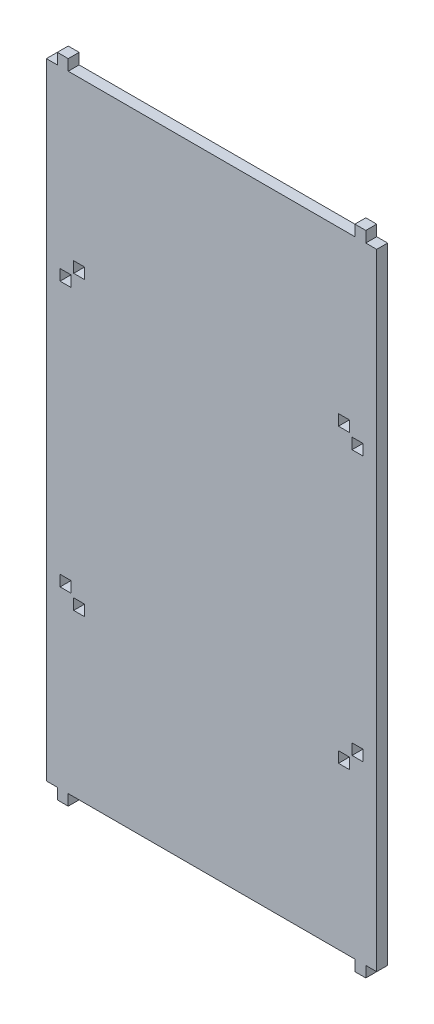
from build123d import *

# Parameters (mm, degrees)
SKETCH1_W           = 46.6
SKETCH1_H           = 97.8
BOSS_EXTRUDE1_DEPTH = 1.65
SKETCH3_W           = 1.65
SKETCH3_H           = 94.5
BOSS_EXTRUDE2_DEPTH = 1.65
SKETCH2_W           = 1.65
SKETCH2_H           = 1.65
CUT_EXTRUDE1_DEPTH  = 1.65
SKETCH4_W           = 43.3
SKETCH4_H           = 1.65
CUT_EXTRUDE2_DEPTH  = 1.65


with BuildPart() as part:
    # Sketch1 → Boss-Extrude1 (new body)
    with BuildSketch(Plane.XY):
        Rectangle(SKETCH1_W, SKETCH1_H)
    extrude(amount=BOSS_EXTRUDE1_DEPTH)

    # Sketch3 → Boss-Extrude2 (add)
    with BuildSketch(Plane.ZY.offset(23.3)):
        with Locations((0.825, 0)):
            Rectangle(SKETCH3_W, SKETCH3_H)
    boss_extrude2 = extrude(amount=BOSS_EXTRUDE2_DEPTH)

    # Mirror1: Boss-Extrude2 across plane
    add(boss_extrude2.mirror(Plane(origin=(0, 0, 0), x_dir=(0, 0, 1), z_dir=(1, 0, 0))))

    # Sketch2 → Cut-Extrude1 (cut)
    with BuildSketch(Plane.XY.offset(1.65)):
        with Locations((22.05, 20)):
            Rectangle(SKETCH2_W, SKETCH2_H)
        with Locations((22.05, -20)):
            Rectangle(SKETCH2_W, SKETCH2_H)
        with Locations((20, -22.05)):
            Rectangle(SKETCH2_W, SKETCH2_H)
        with Locations((-20, -22.05)):
            Rectangle(SKETCH2_W, SKETCH2_H)
        with Locations((-22.05, -20)):
            Rectangle(SKETCH2_W, SKETCH2_H)
        with Locations((-22.05, 20)):
            Rectangle(SKETCH2_W, SKETCH2_H)
        with Locations((-20, 22.05)):
            Rectangle(SKETCH2_W, SKETCH2_H)
        with Locations((20, 22.05)):
            Rectangle(SKETCH2_W, SKETCH2_H)
    extrude(amount=-CUT_EXTRUDE1_DEPTH, mode=Mode.SUBTRACT)

    # Sketch4 → Cut-Extrude2 (cut)
    with BuildSketch(Plane.XZ.offset(48.9)):
        with Locations((0, 0.825)):
            Rectangle(SKETCH4_W, SKETCH4_H)
    cut_extrude2 = extrude(amount=-CUT_EXTRUDE2_DEPTH, mode=Mode.SUBTRACT)

    # Mirror2: Cut-Extrude2 across plane
    add(cut_extrude2.mirror(Plane.ZX), mode=Mode.SUBTRACT)


solid = part.part
